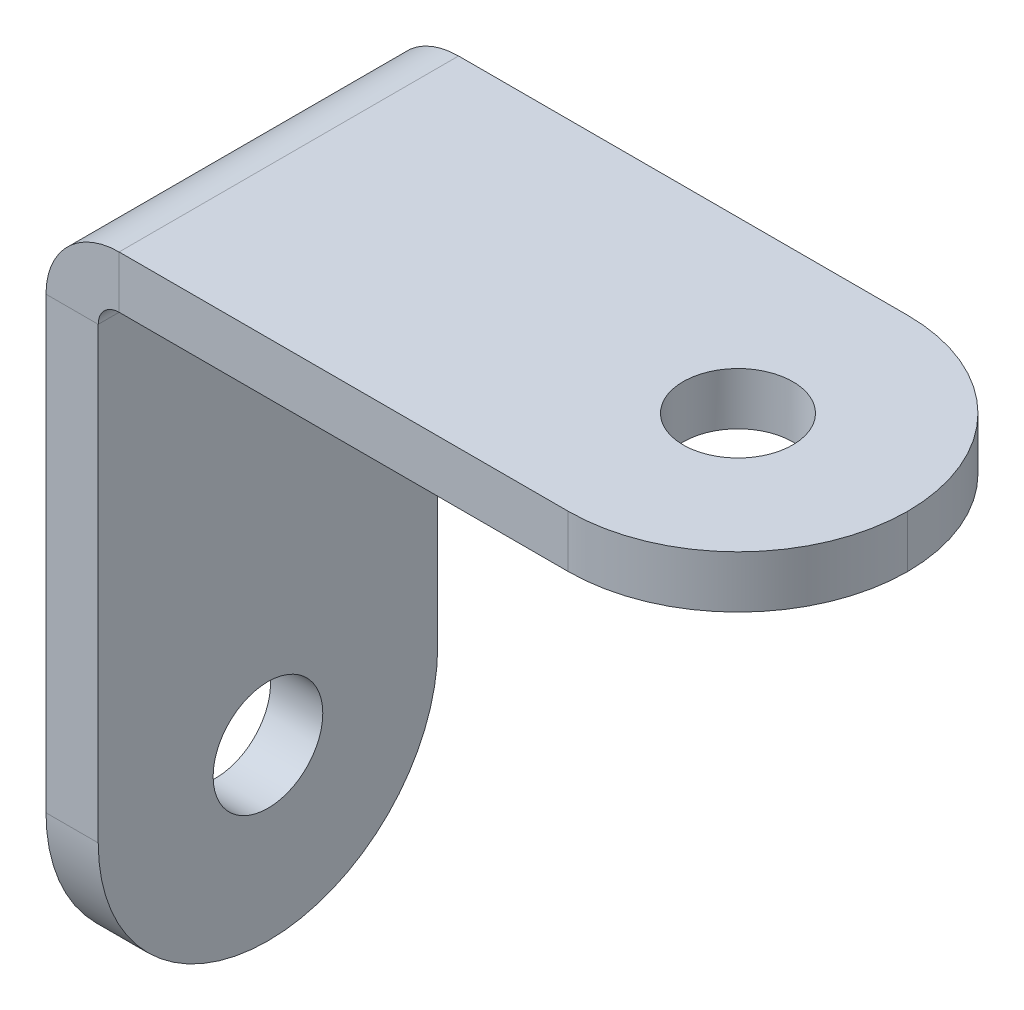
from build123d import *

# Parameters (mm, degrees)
BASE_FLANGE1_DEPTH    = 13
FILLET1_R             = 6.5
M5X0_8_TAPPED_HOLE1_D = 4.2
M5X0_8_TAPPED_HOLE2_D = 4.2


# Sheet-metal steps are written as plain solids
with BuildPart() as part:
    # Sketch1 → Base-Flange1 (new body)
    with BuildSketch(Plane.XY):
        with BuildLine():
            Line((13.25, 13.25), (-10.45, 13.25))
            ThreePointArc((-10.45, 13.25), (-12.429898987, 12.429898987), (-13.25, 10.45))
            Line((-13.25, 10.45), (-13.25, -13.25))
            Line((-13.25, -13.25), (-11.25, -13.25))
            Line((-11.25, -13.25), (-11.25, 10.45))
            ThreePointArc((-11.25, 10.45), (-11.015685425, 11.015685425), (-10.45, 11.25))
            Line((-10.45, 11.25), (13.25, 11.25))
            Line((13.25, 11.25), (13.25, 13.25))
        make_face()
    extrude(amount=BASE_FLANGE1_DEPTH)

    # Fillet1
    fillet1_edges = [part.edges().sort_by_distance(p)[0] for p in [
        (-12.25, -13.25, 0),
        (-12.25, -13.25, 13),
        (13.25, 12.25, 0),
        (13.25, 12.25, 13),
    ]]
    fillet(fillet1_edges, radius=FILLET1_R - 0.0001)  # a hair under: the kernel refuses the full size

    # M5x0.8 Tapped Hole1 (through all)
    with Locations(Plane(origin=(0, 13.25, 0), x_dir=(-1, 0, 0), z_dir=(0, 1, 0))):
        with Locations((-6.75, 6.5)):
            Hole(M5X0_8_TAPPED_HOLE1_D / 2)

    # M5x0.8 Tapped Hole2 (through all)
    with Locations(Plane.ZY.offset(13.25)):
        with Locations((6.5, -6.75)):
            Hole(M5X0_8_TAPPED_HOLE2_D / 2)


solid = part.part
